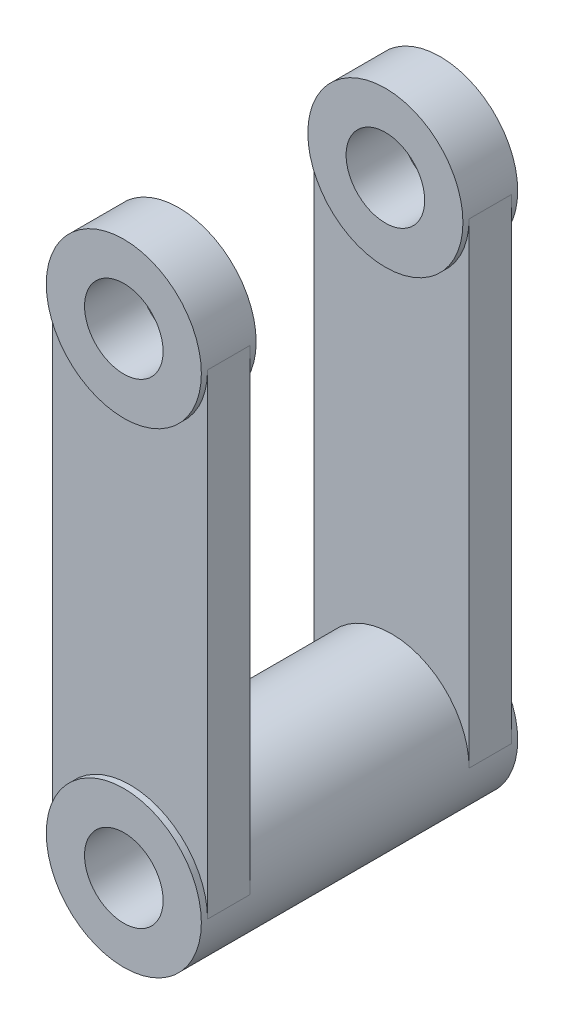
from build123d import *

# Parameters (mm, degrees)
SKETCH1_R           = 75
SKETCH1_R_2         = 38
BOSS_EXTRUDE1_DEPTH = 153
BOSS_EXTRUDE2_START = -6
BOSS_EXTRUDE2_DEPTH = 41
SKETCH4_6_R         = 38
BOSS_EXTRUDE3_DEPTH = 53


with BuildPart() as part:
    # Sketch1 → Boss-Extrude1 (new, symmetric)
    with BuildSketch(Plane.XY):
        Circle(SKETCH1_R)
        Circle(SKETCH1_R_2, mode=Mode.SUBTRACT)
    extrude(amount=BOSS_EXTRUDE1_DEPTH, both=True)

    # Sketch4 → Boss-Extrude2 (add)
    with BuildSketch(Plane.XY.offset(153).offset(BOSS_EXTRUDE2_START)):
        with BuildLine():
            Line((-75, 460), (-75, 0))
            ThreePointArc((-75, 0), (0, 75), (75, 0))
            Line((75, 0), (75, 460))
            ThreePointArc((75, 460), (0, 385), (-75, 460))
        make_face()
    boss_extrude2 = extrude(amount=-BOSS_EXTRUDE2_DEPTH)

    # Sketch4<6> → Boss-Extrude3 (add)
    with BuildSketch(Plane.XY.offset(153)):
        with BuildLine():
            ThreePointArc((-75, 460), (0, 385), (75, 460))
            ThreePointArc((75, 460), (0, 535), (-75, 460))
        make_face()
        with Locations((0, 460)):
            Circle(SKETCH4_6_R, mode=Mode.SUBTRACT)
    boss_extrude3 = extrude(amount=-BOSS_EXTRUDE3_DEPTH)

    # Mirror1: Boss-Extrude2, Boss-Extrude3 across plane
    add(boss_extrude2.mirror(Plane.XY))
    add(boss_extrude3.mirror(Plane.XY))


solid = part.part
